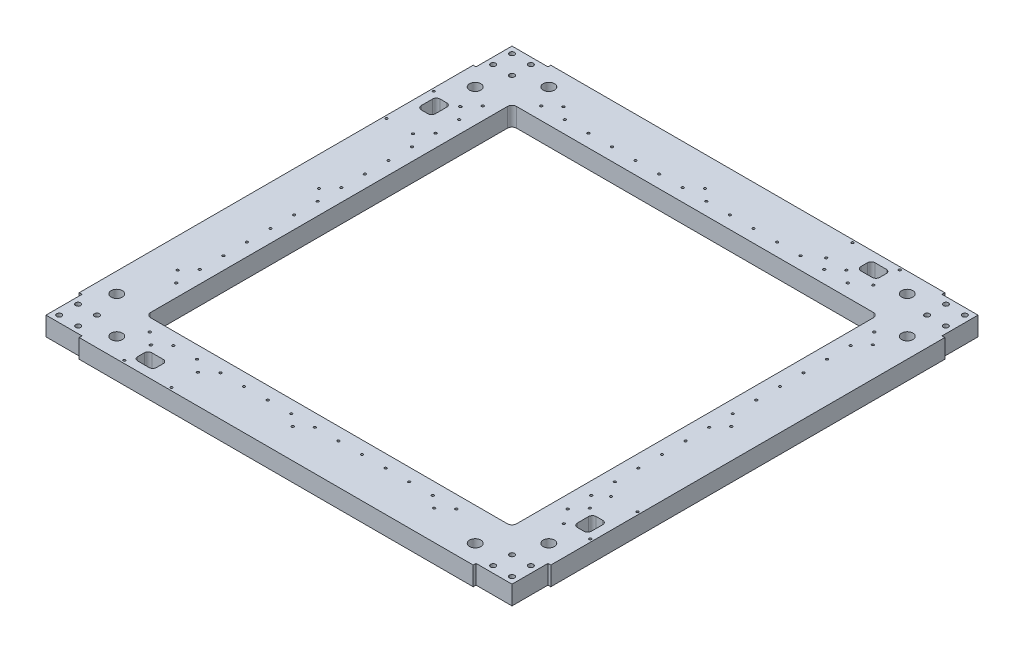
from build123d import *

# Parameters (mm, degrees)
SKETCH1_W                            = 500
SKETCH1_H                            = 500
BOSS_EXTRUDE1_DEPTH                  = 20
M5_CLEARANCE_HOLE1_D                 = 5.3
BEARING_PRESS_FIT_D                  = 12
CIRPATTERN1_COUNT                    = 4
SKETCH5_W                            = 388
SKETCH5_H                            = 388
CUT_EXTRUDE1_DEPTH                   = 20
SKETCH10_W                           = 428
SKETCH10_H                           = 428
SKETCH10_W_2                         = 403
SKETCH10_H_2                         = 403
LINEAR_RAIL_SLOT_DEPTH               = 2.5
FILLET2_R                            = 5
TAP_DRILL_FOR_M3X0_5_TAP1_D          = 2.5
CUT_EXTRUDE2_DEPTH                   = 3.5
TAP_DRILL_FOR_M3X0_5_TAP2_D          = 2.5
MIRROR6_COPY_1_D                     = 2.5
MIRROR6_COPY_2_DEPTH                 = 3.5
MIRROR6_COPY_3_D                     = 2.5
BOSS_EXTRUDE2_DEPTH                  = 2.5
TAP_DRILL_FOR_M3X0_5_TAP3_AT_2_COUNT = 2
TAP_DRILL_FOR_M3X0_5_TAP3_AT_2_PITCH = 28
TAP_DRILL_FOR_M3X0_5_TAP3_AT_3_COUNT = 2
TAP_DRILL_FOR_M3X0_5_TAP3_AT_3_PITCH = 57.306195128
TAP_DRILL_FOR_M3X0_5_TAP3_AT_4_COUNT = 2
TAP_DRILL_FOR_M3X0_5_TAP3_AT_4_PITCH = 50
CUT_EXTRUDE3_DEPTH                   = 355.118624193
CUT_EXTRUDE4_DEPTH                   = 20
CIRPATTERN2_COUNT                    = 4
FILLET3_R                            = 4


with BuildPart() as part:
    # Sketch1 → Boss-Extrude1 (new body)
    with BuildSketch(Plane(origin=(0, 0, 0), x_dir=(1, 0, 0), z_dir=(0, 1, 0))):
        Rectangle(SKETCH1_W, SKETCH1_H)
    extrude(amount=BOSS_EXTRUDE1_DEPTH)

    # M5 Clearance Hole1 (through all)
    with Locations(Plane(origin=(0, 20, 0), x_dir=(1, 0, 0), z_dir=(0, 1, 0))):
        with Locations((-240, 240), (-220, 220), (-220, 240), (-240, 220)):
            m5_clearance_hole1 = Hole(M5_CLEARANCE_HOLE1_D / 2)

    # Bearing Press Fit (through all)
    with Locations(Plane(origin=(0, 20, 0), x_dir=(1, 0, 0), z_dir=(0, 1, 0))):
        with Locations((-190, 229), (-229, 190)):
            bearing_press_fit = Hole(BEARING_PRESS_FIT_D / 2)

    # CirPattern1: M5 Clearance Hole1, Bearing Press Fit ×4 about axis
    cirpattern1_axis = Axis((0, 0, 0), (0, 1, 0))
    add([m5_clearance_hole1.rotate(cirpattern1_axis, i * 360 / CIRPATTERN1_COUNT) for i in range(1, CIRPATTERN1_COUNT)], mode=Mode.SUBTRACT)
    add([bearing_press_fit.rotate(cirpattern1_axis, i * 360 / CIRPATTERN1_COUNT) for i in range(1, CIRPATTERN1_COUNT)], mode=Mode.SUBTRACT)

    # Sketch5 → Cut-Extrude1 (cut)
    with BuildSketch(Plane(origin=(0, 20, 0), x_dir=(1, 0, 0), z_dir=(0, 1, 0))):
        Rectangle(SKETCH5_W, SKETCH5_H)
    extrude(amount=-CUT_EXTRUDE1_DEPTH, mode=Mode.SUBTRACT)

    # Sketch10 → Linear Rail Slot (cut)
    with BuildSketch(Plane(origin=(0, 0, 0), x_dir=(1, 0, 0), z_dir=(0, 1, 0))):
        Rectangle(SKETCH10_W, SKETCH10_H)
        Rectangle(SKETCH10_W_2, SKETCH10_H_2, mode=Mode.SUBTRACT)
    extrude(amount=LINEAR_RAIL_SLOT_DEPTH, mode=Mode.SUBTRACT)

    # Fillet2
    fillet2_edges = [part.edges().sort_by_distance(p)[0] for p in [
        (-194, 10, 194),
        (-194, 10, -194),
        (194, 10, -194),
        (194, 10, 194),
    ]]
    fillet(fillet2_edges, radius=FILLET2_R)

    # Tap Drill for M3x0.5 Tap1 (through all)
    with Locations(Plane(origin=(0, 2.5, 0), x_dir=(-1, 0, 0), z_dir=(0, -1, 0))):
        with Locations((-148.5, -207.5), (-123.5, -207.5), (-98.5, -207.5), (-73.5, -207.5), (-48.5, -207.5), (-23.5, -207.5), (1.5, -207.5), (26.5, -207.5), (51.5, -207.5), (76.5, -207.5), (101.5, -207.5), (126.5, -207.5), (151.5, -207.5), (176.5, -207.5)):
            tap_drill_for_m3x0_5_tap1 = Hole(TAP_DRILL_FOR_M3X0_5_TAP1_D / 2)

    # Sketch14 → Cut-Extrude2 (cut)
    with BuildSketch(Plane.XZ):
        with BuildLine():
            Line((-151.5, 213.5), (-176.5, 213.5))
            ThreePointArc((-176.5, 213.5), (-179.328427125, 214.671572875), (-180.5, 217.5))
            Line((-180.5, 217.5), (-180.5, 219.5))
            ThreePointArc((-180.5, 219.5), (-179.328427125, 222.328427125), (-176.5, 223.5))
            Line((-176.5, 223.5), (-151.5, 223.5))
            ThreePointArc((-151.5, 223.5), (-148.671572875, 222.328427125), (-147.5, 219.5))
            Line((-147.5, 219.5), (-147.5, 217.5))
            ThreePointArc((-147.5, 217.5), (-148.671572875, 214.671572875), (-151.5, 213.5))
        make_face()
        with BuildLine():
            Line((-1.5, 213.5), (-26.5, 213.5))
            ThreePointArc((-26.5, 213.5), (-29.328427125, 214.671572875), (-30.5, 217.5))
            Line((-30.5, 217.5), (-30.5, 219.5))
            ThreePointArc((-30.5, 219.5), (-29.328427125, 222.328427125), (-26.5, 223.5))
            Line((-26.5, 223.5), (-1.5, 223.5))
            ThreePointArc((-1.5, 223.5), (1.328427125, 222.328427125), (2.5, 219.5))
            Line((2.5, 219.5), (2.5, 217.5))
            ThreePointArc((2.5, 217.5), (1.328427125, 214.671572875), (-1.5, 213.5))
        make_face()
        with BuildLine():
            Line((148.5, 213.5), (123.5, 213.5))
            ThreePointArc((123.5, 213.5), (120.671572875, 214.671572875), (119.5, 217.5))
            Line((119.5, 217.5), (119.5, 219.5))
            ThreePointArc((119.5, 219.5), (120.671572875, 222.328427125), (123.5, 223.5))
            Line((123.5, 223.5), (148.5, 223.5))
            ThreePointArc((148.5, 223.5), (151.328427125, 222.328427125), (152.5, 219.5))
            Line((152.5, 219.5), (152.5, 217.5))
            ThreePointArc((152.5, 217.5), (151.328427125, 214.671572875), (148.5, 213.5))
        make_face()
    cut_extrude2 = extrude(amount=-CUT_EXTRUDE2_DEPTH, mode=Mode.SUBTRACT)

    # Tap Drill for M3x0.5 Tap2 (through all)
    with Locations(Plane(origin=(0, 3.5, 0), x_dir=(-1, 0, 0), z_dir=(0, -1, 0))):
        with Locations((-136, -218.5), (14, -218.5), (164, -218.5)):
            tap_drill_for_m3x0_5_tap2 = Hole(TAP_DRILL_FOR_M3X0_5_TAP2_D / 2)

    # Mirror5: Tap Drill for M3x0.5 Tap1, Cut-Extrude2, Tap Drill for M3x0.5 Tap2 across plane
    add(tap_drill_for_m3x0_5_tap1.mirror(Plane.XY), mode=Mode.SUBTRACT)
    add(cut_extrude2.mirror(Plane.XY), mode=Mode.SUBTRACT)
    add(tap_drill_for_m3x0_5_tap2.mirror(Plane.XY), mode=Mode.SUBTRACT)

    # Mirror6: Tap Drill for M3x0.5 Tap1, Cut-Extrude2, Tap Drill for M3x0.5 Tap2 across plane
    add(tap_drill_for_m3x0_5_tap1.mirror(Plane(origin=(0, 0, 0), x_dir=(0.7071067811865478, 0, 0.7071067811865472), z_dir=(-0.7071067811865475, 0, 0.7071067811865477))), mode=Mode.SUBTRACT)
    add(cut_extrude2.mirror(Plane(origin=(0, 0, 0), x_dir=(0.7071067811865478, 0, 0.7071067811865472), z_dir=(-0.7071067811865475, 0, 0.7071067811865477))), mode=Mode.SUBTRACT)
    add(tap_drill_for_m3x0_5_tap2.mirror(Plane(origin=(0, 0, 0), x_dir=(0.7071067811865478, 0, 0.7071067811865472), z_dir=(-0.7071067811865475, 0, 0.7071067811865477))), mode=Mode.SUBTRACT)

    # Mirror6 copy 1 (through all)
    with Locations(Plane(origin=(0, 2.5, 0), x_dir=(0, 0, -1), z_dir=(0, -1, 0))):
        with Locations((-148.5, -207.5), (-123.5, -207.5), (-98.5, -207.5), (-73.5, -207.5), (-48.5, -207.5), (-23.5, -207.5), (1.5, -207.5), (26.5, -207.5), (51.5, -207.5), (76.5, -207.5), (101.5, -207.5), (126.5, -207.5), (151.5, -207.5), (176.5, -207.5)):
            Hole(MIRROR6_COPY_1_D / 2)

    # Mirror6 copy 2 sketch → Mirror6 copy 2 (cut)
    with BuildSketch(Plane(origin=(0, 0, 0), x_dir=(0, 0, 1), z_dir=(0, -1, 0))):
        with BuildLine():
            Line((-151.5, 213.5), (-176.5, 213.5))
            ThreePointArc((-176.5, 213.5), (-179.328427125, 214.671572875), (-180.5, 217.5))
            Line((-180.5, 217.5), (-180.5, 219.5))
            ThreePointArc((-180.5, 219.5), (-179.328427125, 222.328427125), (-176.5, 223.5))
            Line((-176.5, 223.5), (-151.5, 223.5))
            ThreePointArc((-151.5, 223.5), (-148.671572875, 222.328427125), (-147.5, 219.5))
            Line((-147.5, 219.5), (-147.5, 217.5))
            ThreePointArc((-147.5, 217.5), (-148.671572875, 214.671572875), (-151.5, 213.5))
        make_face()
        with BuildLine():
            Line((-1.5, 213.5), (-26.5, 213.5))
            ThreePointArc((-26.5, 213.5), (-29.328427125, 214.671572875), (-30.5, 217.5))
            Line((-30.5, 217.5), (-30.5, 219.5))
            ThreePointArc((-30.5, 219.5), (-29.328427125, 222.328427125), (-26.5, 223.5))
            Line((-26.5, 223.5), (-1.5, 223.5))
            ThreePointArc((-1.5, 223.5), (1.328427125, 222.328427125), (2.5, 219.5))
            Line((2.5, 219.5), (2.5, 217.5))
            ThreePointArc((2.5, 217.5), (1.328427125, 214.671572875), (-1.5, 213.5))
        make_face()
        with BuildLine():
            Line((148.5, 213.5), (123.5, 213.5))
            ThreePointArc((123.5, 213.5), (120.671572875, 214.671572875), (119.5, 217.5))
            Line((119.5, 217.5), (119.5, 219.5))
            ThreePointArc((119.5, 219.5), (120.671572875, 222.328427125), (123.5, 223.5))
            Line((123.5, 223.5), (148.5, 223.5))
            ThreePointArc((148.5, 223.5), (151.328427125, 222.328427125), (152.5, 219.5))
            Line((152.5, 219.5), (152.5, 217.5))
            ThreePointArc((152.5, 217.5), (151.328427125, 214.671572875), (148.5, 213.5))
        make_face()
    extrude(amount=-MIRROR6_COPY_2_DEPTH, mode=Mode.SUBTRACT)

    # Mirror6 copy 3 (through all)
    with Locations(Plane(origin=(0, 3.5, 0), x_dir=(0, 0, -1), z_dir=(0, -1, 0))):
        with Locations((-136, -218.5), (14, -218.5), (164, -218.5)):
            Hole(MIRROR6_COPY_3_D / 2)

    # Sketch19 → Boss-Extrude2 (add)
    with BuildSketch(Plane.XZ.offset(-2.5)):
        Polygon((-198.5, 201.5), (-198.5, 214), (-214, 214), (-214, 198.5), (-201.5, 198.5), (-201.5, 201.5), align=None)
    boss_extrude2 = extrude(amount=BOSS_EXTRUDE2_DEPTH)

    # Sketch22 → Tap Drill for M3x0.5 Tap3 (revolve, cut)
    with BuildSketch(Plane(origin=(247, 20, 114), x_dir=(0, 0, 1), z_dir=(1, 0, 0))):
        Polygon((0, 0), (0, 10.751075774), (1.25, 10), (1.25, 0), align=None)
    tap_drill_for_m3x0_5_tap3 = revolve(axis=Axis((247, 26.35, 114), (0, -1, 0)), mode=Mode.SUBTRACT)

    # Tap Drill for M3x0.5 Tap3 at 2: Tap Drill for M3x0.5 Tap3 ×2
    with Locations(*[(-i * TAP_DRILL_FOR_M3X0_5_TAP3_AT_2_PITCH, 0, 0) for i in range(1, TAP_DRILL_FOR_M3X0_5_TAP3_AT_2_COUNT)]):
        add(tap_drill_for_m3x0_5_tap3, mode=Mode.SUBTRACT)

    # Tap Drill for M3x0.5 Tap3 at 3: Tap Drill for M3x0.5 Tap3 ×2
    with Locations(*[Vector(-0.48860336893184325, 0, 0.8725060159497201) * (i * TAP_DRILL_FOR_M3X0_5_TAP3_AT_3_PITCH) for i in range(1, TAP_DRILL_FOR_M3X0_5_TAP3_AT_3_COUNT)]):
        add(tap_drill_for_m3x0_5_tap3, mode=Mode.SUBTRACT)

    # Tap Drill for M3x0.5 Tap3 at 4: Tap Drill for M3x0.5 Tap3 ×2
    with Locations(*[(0, 0, i * TAP_DRILL_FOR_M3X0_5_TAP3_AT_4_PITCH) for i in range(1, TAP_DRILL_FOR_M3X0_5_TAP3_AT_4_COUNT)]):
        add(tap_drill_for_m3x0_5_tap3, mode=Mode.SUBTRACT)

    # Sketch20 → Cut-Extrude3 (cut, through all)
    with BuildSketch(Plane(origin=(0, 20, 0), x_dir=(1, 0, 0), z_dir=(0, 1, 0))):
        with BuildLine():
            Line((229.5, -160.3), (236.5, -160.3))
            ThreePointArc((236.5, -160.3), (239.328427125, -159.128427125), (240.5, -156.3))
            Line((240.5, -156.3), (240.5, -144.3))
            ThreePointArc((240.5, -144.3), (239.328427125, -141.471572875), (236.5, -140.3))
            Line((236.5, -140.3), (229.5, -140.3))
            ThreePointArc((229.5, -140.3), (226.671572875, -141.471572875), (225.5, -144.3))
            Line((225.5, -144.3), (225.5, -156.3))
            ThreePointArc((225.5, -156.3), (226.671572875, -159.128427125), (229.5, -160.3))
        make_face()
    cut_extrude3 = extrude(amount=-CUT_EXTRUDE3_DEPTH, mode=Mode.SUBTRACT)

    # Sketch23 → Cut-Extrude4 (cut)
    with BuildSketch(Plane(origin=(0, 20, 0), x_dir=(1, 0, 0), z_dir=(0, 1, 0))):
        Polygon((208.9, -250), (208.9, -247), (247, -247), (247, -208.9), (250, -208.9), (250, -250), align=None)
    cut_extrude4 = extrude(amount=-CUT_EXTRUDE4_DEPTH, mode=Mode.SUBTRACT)

    # CirPattern2: Boss-Extrude2, Tap Drill for M3x0.5 Tap3, Cut-Extrude3, Cut-Extrude4 ×4 about axis
    cirpattern2_axis = Axis((0, 0, 0), (0, 1, 0))
    add([boss_extrude2.rotate(cirpattern2_axis, i * 360 / CIRPATTERN2_COUNT) for i in range(1, CIRPATTERN2_COUNT)])
    add([tap_drill_for_m3x0_5_tap3.rotate(cirpattern2_axis, i * 360 / CIRPATTERN2_COUNT) for i in range(1, CIRPATTERN2_COUNT)], mode=Mode.SUBTRACT)
    add([cut_extrude3.rotate(cirpattern2_axis, i * 360 / CIRPATTERN2_COUNT) for i in range(1, CIRPATTERN2_COUNT)], mode=Mode.SUBTRACT)
    add([cut_extrude4.rotate(cirpattern2_axis, i * 360 / CIRPATTERN2_COUNT) for i in range(1, CIRPATTERN2_COUNT)], mode=Mode.SUBTRACT)

    # CirPattern2 copy 1 sketch → CirPattern2 copy 1 (revolve, cut)
    with BuildSketch(Plane(origin=(114, 20, -219), x_dir=(1, 0, 0), z_dir=(0, 0, -1))):
        Polygon((0, 0), (0, 10.751075774), (1.25, 10), (1.25, 0), align=None)
    revolve(axis=Axis((114, 26.35, -219), (0, -1, 0)), mode=Mode.SUBTRACT)

    # CirPattern2 copy 2 sketch → CirPattern2 copy 2 (revolve, cut)
    with BuildSketch(Plane(origin=(-219, 20, -114), x_dir=(0, 0, -1), z_dir=(-1, 0, 0))):
        Polygon((0, 0), (0, 10.751075774), (1.25, 10), (1.25, 0), align=None)
    revolve(axis=Axis((-219, 26.35, -114), (0, -1, 0)), mode=Mode.SUBTRACT)

    # CirPattern2 copy 3 sketch → CirPattern2 copy 3 (revolve, cut)
    with BuildSketch(Plane(origin=(-114, 20, 219), x_dir=(-1, 0, 0), z_dir=(0, 0, 1))):
        Polygon((0, 0), (0, 10.751075774), (1.25, 10), (1.25, 0), align=None)
    revolve(axis=Axis((-114, 26.35, 219), (0, -1, 0)), mode=Mode.SUBTRACT)

    # CirPattern2 copy 4 sketch → CirPattern2 copy 4 (revolve, cut)
    with BuildSketch(Plane(origin=(164, 20, -219), x_dir=(1, 0, 0), z_dir=(0, 0, -1))):
        Polygon((0, 0), (0, 10.751075774), (1.25, 10), (1.25, 0), align=None)
    revolve(axis=Axis((164, 26.35, -219), (0, -1, 0)), mode=Mode.SUBTRACT)

    # CirPattern2 copy 5 sketch → CirPattern2 copy 5 (revolve, cut)
    with BuildSketch(Plane(origin=(-219, 20, -164), x_dir=(0, 0, -1), z_dir=(-1, 0, 0))):
        Polygon((0, 0), (0, 10.751075774), (1.25, 10), (1.25, 0), align=None)
    revolve(axis=Axis((-219, 26.35, -164), (0, -1, 0)), mode=Mode.SUBTRACT)

    # CirPattern2 copy 6 sketch → CirPattern2 copy 6 (revolve, cut)
    with BuildSketch(Plane(origin=(-164, 20, 219), x_dir=(-1, 0, 0), z_dir=(0, 0, 1))):
        Polygon((0, 0), (0, 10.751075774), (1.25, 10), (1.25, 0), align=None)
    revolve(axis=Axis((-164, 26.35, 219), (0, -1, 0)), mode=Mode.SUBTRACT)

    # CirPattern2 copy 7 sketch → CirPattern2 copy 7 (revolve, cut)
    with BuildSketch(Plane(origin=(164, 20, -247), x_dir=(1, 0, 0), z_dir=(0, 0, -1))):
        Polygon((0, 0), (0, 10.751075774), (1.25, 10), (1.25, 0), align=None)
    revolve(axis=Axis((164, 26.35, -247), (0, -1, 0)), mode=Mode.SUBTRACT)

    # CirPattern2 copy 8 sketch → CirPattern2 copy 8 (revolve, cut)
    with BuildSketch(Plane(origin=(-247, 20, -164), x_dir=(0, 0, -1), z_dir=(-1, 0, 0))):
        Polygon((0, 0), (0, 10.751075774), (1.25, 10), (1.25, 0), align=None)
    revolve(axis=Axis((-247, 26.35, -164), (0, -1, 0)), mode=Mode.SUBTRACT)

    # CirPattern2 copy 9 sketch → CirPattern2 copy 9 (revolve, cut)
    with BuildSketch(Plane(origin=(-164, 20, 247), x_dir=(-1, 0, 0), z_dir=(0, 0, 1))):
        Polygon((0, 0), (0, 10.751075774), (1.25, 10), (1.25, 0), align=None)
    revolve(axis=Axis((-164, 26.35, 247), (0, -1, 0)), mode=Mode.SUBTRACT)

    # Fillet3
    # the kernel refuses this fillet: 4 mm, written as the material it adds along each edge
    with BuildSketch(Plane(origin=(198.5, 12.5, -214), x_dir=(-1, 0, 0), z_dir=(0, -1, 0)), Plane(origin=(198.5, 12.5, -201.5), x_dir=(0, 0, -1), z_dir=(0, -1, 0)), Plane(origin=(214, 12.5, -198.5), x_dir=(-1, 0, 0), z_dir=(0, -1, 0)), Plane(origin=(201.5, 12.5, -198.5), x_dir=(0, 0, 1), z_dir=(0, -1, 0)), Plane(origin=(214, 12.5, 198.5), x_dir=(0, 0, -1), z_dir=(0, -1, 0)), Plane(origin=(201.5, 12.5, 198.5), x_dir=(1, 0, 0), z_dir=(0, -1, 0)), Plane(origin=(-201.5, 12.5, 198.5), x_dir=(0, 0, -1), z_dir=(0, -1, 0)), Plane(origin=(-214, 12.5, 198.5), x_dir=(1, 0, 0), z_dir=(0, -1, 0)), Plane(origin=(-214, 12.5, -198.5), x_dir=(0, 0, 1), z_dir=(0, -1, 0)), Plane(origin=(-201.5, 12.5, -198.5), x_dir=(-1, 0, 0), z_dir=(0, -1, 0)), Plane(origin=(-198.5, 12.5, -214), x_dir=(0, 0, 1), z_dir=(0, -1, 0)), Plane(origin=(-198.5, 12.5, -201.5), x_dir=(1, 0, 0), z_dir=(0, -1, 0))) as fillet3_piece_1:
        with BuildLine():
            CenterArc((FILLET3_R, -FILLET3_R), FILLET3_R, 90, 90)
            Line((0, -FILLET3_R), (0, 0))
            Line((0, 0), (FILLET3_R, 0))
        make_face()
    extrude(amount=12.5)
    with BuildSketch(Plane(origin=(198.5, 12.5, 214), x_dir=(-1, 0, 0), z_dir=(0, -1, 0)), Plane(origin=(198.5, 12.5, 201.5), x_dir=(0, 0, 1), z_dir=(0, -1, 0)), Plane(origin=(-198.5, 12.5, 201.5), x_dir=(1, 0, 0), z_dir=(0, -1, 0)), Plane(origin=(-198.5, 12.5, 214), x_dir=(0, 0, -1), z_dir=(0, -1, 0))) as fillet3_piece_2:
        with BuildLine():
            CenterArc((FILLET3_R, FILLET3_R), FILLET3_R, 180, 90)
            Line((0, FILLET3_R), (0, 0))
            Line((0, 0), (FILLET3_R, 0))
        make_face()
    extrude(amount=12.5)
    # the kernel refuses this fillet: 4 mm, written as the material it takes off along each edge
    with BuildSketch(Plane(origin=(150.436491673, 2.5, 214), x_dir=(1, 0, 0), z_dir=(0, -1, 0)), Plane(origin=(0.436491673, 2.5, 214), x_dir=(1, 0, 0), z_dir=(0, -1, 0)), Plane(origin=(-214, 2.5, 0.436491673), x_dir=(0, 0, 1), z_dir=(0, -1, 0)), Plane(origin=(-214, 2.5, 150.436491673), x_dir=(0, 0, 1), z_dir=(0, -1, 0)), Plane(origin=(-178.436491673, 2.5, -214), x_dir=(-1, 0, 0), z_dir=(0, -1, 0)), Plane(origin=(-28.436491673, 2.5, -214), x_dir=(-1, 0, 0), z_dir=(0, -1, 0)), Plane(origin=(214, 2.5, -178.436491673), x_dir=(0, 0, -1), z_dir=(0, -1, 0)), Plane(origin=(214, 2.5, -28.436491673), x_dir=(0, 0, -1), z_dir=(0, -1, 0))) as fillet3_2_piece_1:
        with BuildLine():
            CenterArc((6.063508327, 4), FILLET3_R, 180, 90)
            Line((2.063508327, 4), (1.663508327, 4))
            ThreePointArc((1.663508327, 4), (1.663508327, 3.5), (-0.193649167, 0.35))
            Line((-0.193649167, 0.35), (0, -0.4))
            Line((0, -0.4), (6.063508327, -0.4))
            Line((6.063508327, -0.4), (6.063508327, 0))
        make_face()
    extrude(amount=17.658770817, mode=Mode.SUBTRACT)
    with BuildSketch(Plane(origin=(121.563508327, 2.5, 214), x_dir=(-0.45846609977040836, 0, 0.888711896714177), z_dir=(0, -1, 0)), Plane(origin=(-214, 2.5, 121.563508327), x_dir=(-0.8887118967141834, 0, -0.45846609977039576), z_dir=(0, -1, 0)), Plane(origin=(-149.563508327, 2.5, -214), x_dir=(0.45846609977039576, 0, -0.8887118967141835), z_dir=(0, -1, 0)), Plane(origin=(214, 2.5, -149.563508327), x_dir=(0.8887118967141732, 0, 0.45846609977041564), z_dir=(0, -1, 0))) as fillet3_2_piece_2:
        with BuildLine():
            CenterArc((6.3347606, 3.554847587), FILLET3_R, 152.711828063, 90)
            Line((2.779913014, 5.388711986), (2.424428255, 5.572098426))
            Line((2.424428255, 5.572098426), (-0.355484759, 0.18338644))
            Line((-0.355484759, 0.18338644), (0.222267585, -0.332561454))
            ThreePointArc((0.222267585, -0.332561454), (3.873153813, -0.126251709), (4.317509761, -0.355484759))
            Line((4.317509761, -0.355484759), (4.500896201, 0))
        make_face()
    extrude(amount=17.658770817, mode=Mode.SUBTRACT)
    with BuildSketch(Plane(origin=(-28.436491673, 2.5, 214), x_dir=(-1, 0, 0), z_dir=(0, -1, 0)), Plane(origin=(-178.436491673, 2.5, 214), x_dir=(-1, 0, 0), z_dir=(0, -1, 0)), Plane(origin=(-214, 2.5, -178.436491673), x_dir=(0, 0, -1), z_dir=(0, -1, 0)), Plane(origin=(-214, 2.5, -28.436491673), x_dir=(0, 0, -1), z_dir=(0, -1, 0)), Plane(origin=(0.436491673, 2.5, -214), x_dir=(1, 0, 0), z_dir=(0, -1, 0)), Plane(origin=(150.436491673, 2.5, -214), x_dir=(1, 0, 0), z_dir=(0, -1, 0)), Plane(origin=(214, 2.5, 0.436491673), x_dir=(0, 0, 1), z_dir=(0, -1, 0)), Plane(origin=(214, 2.5, 150.436491673), x_dir=(0, 0, 1), z_dir=(0, -1, 0))) as fillet3_2_piece_3:
        with BuildLine():
            CenterArc((6.063508327, -4), FILLET3_R, 90, 90)
            Line((2.063508327, -4), (1.663508327, -4))
            ThreePointArc((1.663508327, -4), (1.663508327, -3.5), (-0.193649167, -0.35))
            Line((-0.193649167, -0.35), (0, 0.4))
            Line((0, 0.4), (6.063508327, 0.4))
            Line((6.063508327, 0.4), (6.063508327, 0))
        make_face()
    extrude(amount=17.658770817, mode=Mode.SUBTRACT)
    with BuildSketch(Plane(origin=(-149.563508327, 2.5, 214), x_dir=(0.45846609977040576, 0, 0.8887118967141785), z_dir=(0, -1, 0)), Plane(origin=(-214, 2.5, -149.563508327), x_dir=(-0.8887118967141732, 0, 0.45846609977041564), z_dir=(0, -1, 0)), Plane(origin=(121.563508327, 2.5, -214), x_dir=(-0.45846609977039826, 0, -0.8887118967141822), z_dir=(0, -1, 0)), Plane(origin=(214, 2.5, 121.563508327), x_dir=(0.8887118967141643, 0, -0.45846609977043323), z_dir=(0, -1, 0))) as fillet3_2_piece_4:
        with BuildLine():
            CenterArc((6.3347606, -3.554847587), FILLET3_R, 117.288171937, 90)
            Line((2.779913014, -5.388711986), (2.424428255, -5.572098426))
            Line((2.424428255, -5.572098426), (-0.355484759, -0.18338644))
            Line((-0.355484759, -0.18338644), (0.222267585, 0.332561454))
            ThreePointArc((0.222267585, 0.332561454), (3.873153813, 0.126251709), (4.317509761, 0.355484759))
            Line((4.317509761, 0.355484759), (4.500896201, 0))
        make_face()
    extrude(amount=17.658770817, mode=Mode.SUBTRACT)


solid = part.part
